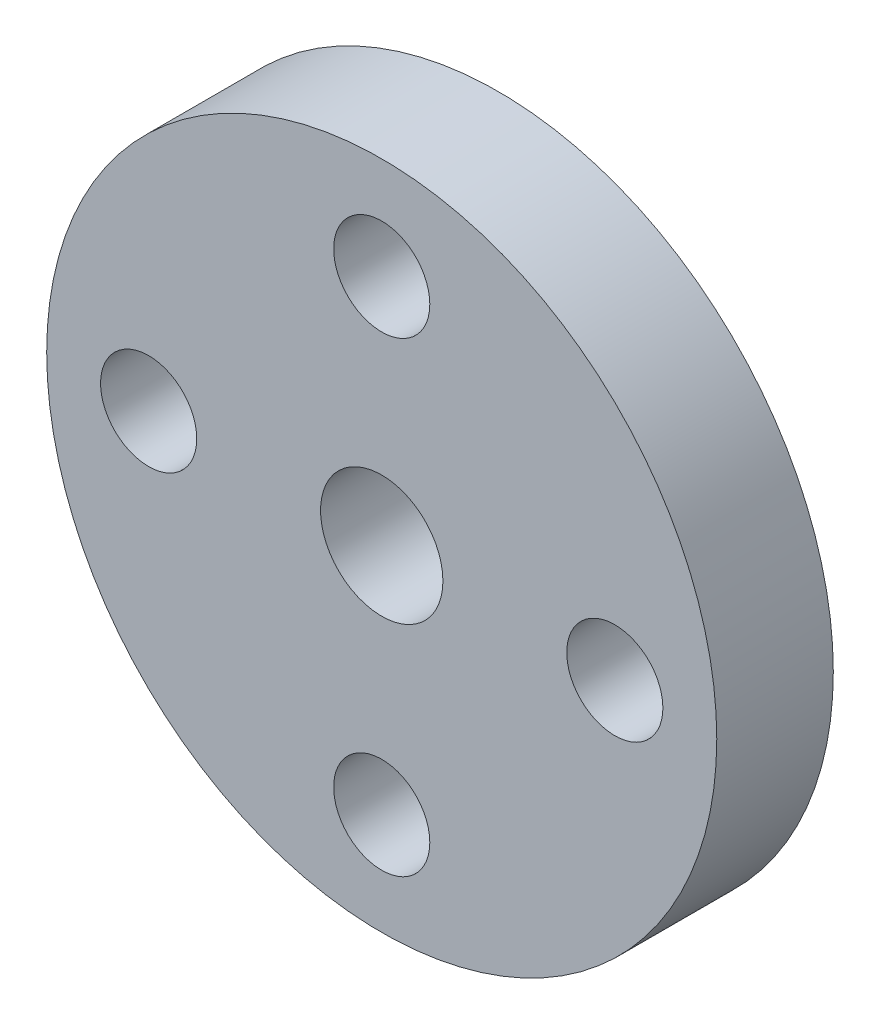
from build123d import *

# Parameters (mm, degrees)
SKETCH_1_R      = 11.5
SKETCH_1_R_2    = 1.65
SKETCH_1_R_3    = 2.1
EXTRUDE_1_DEPTH = 4


with BuildPart() as part:
    # 草圖1 → 填料-伸長1 (new body)
    with BuildSketch(Plane.XY):
        Circle(SKETCH_1_R)
        with Locations((0, 8)):
            Circle(SKETCH_1_R_2, mode=Mode.SUBTRACT)
        with Locations((8, 0)):
            Circle(SKETCH_1_R_2, mode=Mode.SUBTRACT)
        with Locations((0, -8)):
            Circle(SKETCH_1_R_2, mode=Mode.SUBTRACT)
        with Locations((-8, 0)):
            Circle(SKETCH_1_R_2, mode=Mode.SUBTRACT)
        Circle(SKETCH_1_R_3, mode=Mode.SUBTRACT)
    extrude(amount=EXTRUDE_1_DEPTH)


solid = part.part
